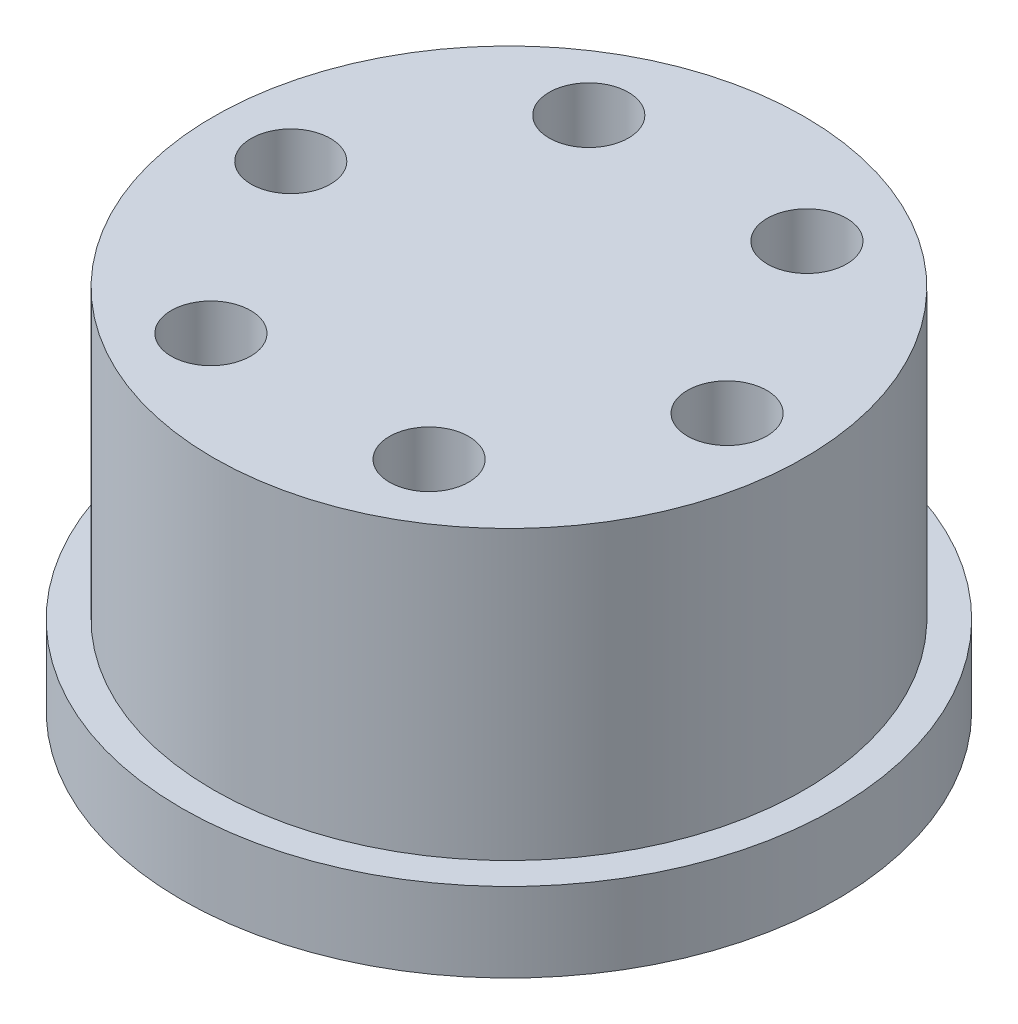
from build123d import *

# Parameters (mm, degrees)
SKETCH1_R           = 16.5
SKETCH1_R_2         = 1.75
BOSS_EXTRUDE1_DEPTH = 4
SKETCH2_R           = 14.9
BOSS_EXTRUDE2_DEPTH = 14.5
SKETCH5_R           = 2
CUT_EXTRUDE3_DEPTH  = 6.5
SKETCH6_R           = 7.6
CUT_EXTRUDE4_DEPTH  = 5


with BuildPart() as part:
    # Sketch1 → Boss-Extrude1 (new body)
    with BuildSketch(Plane(origin=(0, 0, 0), x_dir=(1, 0, 0), z_dir=(0, 1, 0))):
        Circle(SKETCH1_R)
        with Locations((0, 12.5)):
            Circle(SKETCH1_R_2, mode=Mode.SUBTRACT)
        with Locations((10.825317547, 6.25)):
            Circle(SKETCH1_R_2, mode=Mode.SUBTRACT)
        with Locations((10.825317547, -6.25)):
            Circle(SKETCH1_R_2, mode=Mode.SUBTRACT)
        with Locations((0, -12.5)):
            Circle(SKETCH1_R_2, mode=Mode.SUBTRACT)
        with Locations((-10.825317547, -6.25)):
            Circle(SKETCH1_R_2, mode=Mode.SUBTRACT)
        with Locations((-10.825317547, 6.25)):
            Circle(SKETCH1_R_2, mode=Mode.SUBTRACT)
    extrude(amount=BOSS_EXTRUDE1_DEPTH)

    # Sketch2 → Boss-Extrude2 (add)
    with BuildSketch(Plane(origin=(0, 4, 0), x_dir=(1, 0, 0), z_dir=(0, 1, 0))):
        Circle(SKETCH2_R)
    extrude(amount=BOSS_EXTRUDE2_DEPTH)

    # Sketch5 → Cut-Extrude3 (cut)
    with BuildSketch(Plane(origin=(0, 18.5, 0), x_dir=(1, 0, 0), z_dir=(0, 1, 0))):
        with Locations((-11, 0)):
            Circle(SKETCH5_R)
        with Locations((-5.5, 9.526279442)):
            Circle(SKETCH5_R)
        with Locations((5.5, 9.526279442)):
            Circle(SKETCH5_R)
        with Locations((11, 0)):
            Circle(SKETCH5_R)
        with Locations((5.5, -9.526279442)):
            Circle(SKETCH5_R)
        with Locations((-5.5, -9.526279442)):
            Circle(SKETCH5_R)
    extrude(amount=-CUT_EXTRUDE3_DEPTH, mode=Mode.SUBTRACT)

    # Sketch6 → Cut-Extrude4 (cut)
    with BuildSketch(Plane.XZ):
        Circle(SKETCH6_R)
    extrude(amount=-CUT_EXTRUDE4_DEPTH, mode=Mode.SUBTRACT)


solid = part.part
